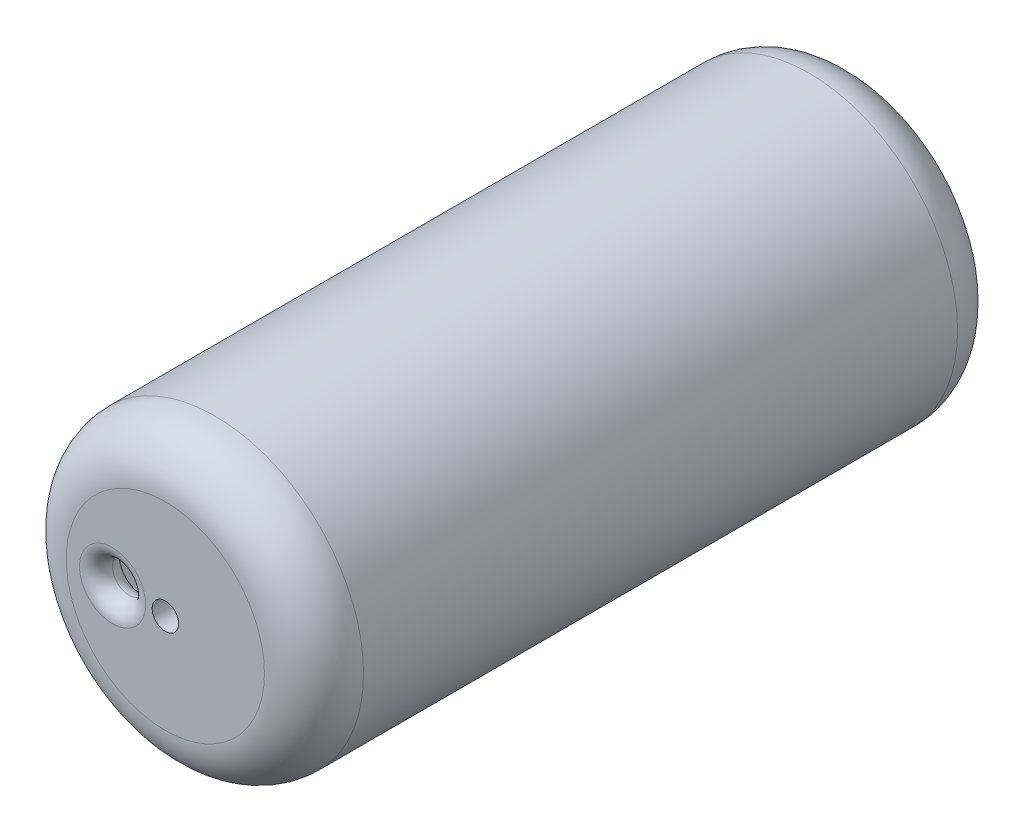
from build123d import *

# Parameters (mm, degrees)
SKETCH2_R           = 14.2875
BOSS_EXTRUDE1_DEPTH = 3.175
SKETCH3_R           = 14.2875
SKETCH3_R_2         = 11.7475
BOSS_EXTRUDE2_DEPTH = 60.2742
SKETCH4_R           = 14.2875
BOSS_EXTRUDE3_DEPTH = 3.175
SKETCH5_R           = 1.27
SKETCH5_R_2         = 1.5875
CUT_EXTRUDE1_DEPTH  = 70.620753645
FILLET1_R           = 4.7625
FILLET2_R           = 1.5875


with BuildPart() as part:
    # Sketch2 → Boss-Extrude1 (new body)
    with BuildSketch(Plane.XY):
        Circle(SKETCH2_R)
    extrude(amount=BOSS_EXTRUDE1_DEPTH)

    # Sketch3 → Boss-Extrude2 (add)
    with BuildSketch(Plane.XY.offset(3.175)):
        Circle(SKETCH3_R)
        Circle(SKETCH3_R_2, mode=Mode.SUBTRACT)
    extrude(amount=BOSS_EXTRUDE2_DEPTH)

    # Sketch4 → Boss-Extrude3 (add)
    with BuildSketch(Plane.XY.offset(63.4492)):
        Circle(SKETCH4_R)
    extrude(amount=BOSS_EXTRUDE3_DEPTH)

    # Sketch5 → Cut-Extrude1 (cut, through all)
    with BuildSketch(Plane.XY.offset(66.6242)):
        Circle(SKETCH5_R)
        with Locations((-5.08, 0)):
            Circle(SKETCH5_R_2)
    extrude(amount=-CUT_EXTRUDE1_DEPTH, mode=Mode.SUBTRACT)

    # Fillet1
    fillet1_edges = [part.edges().sort_by_distance(p)[0] for p in [
        (-14.2875, 0, 66.6242),
        (-14.2875, 0, 0),
    ]]
    fillet(fillet1_edges, radius=FILLET1_R)

    # Fillet2
    fillet2_edges = [part.edges().sort_by_distance(p)[0] for p in [
        (-6.6675, 0, 3.175),
        (-6.6675, 0, 63.4492),
        (-6.6675, 0, 0),
        (-6.6675, 0, 66.6242),
    ]]
    fillet(fillet2_edges, radius=FILLET2_R - 0.0001)  # a hair under: the kernel refuses the full size


solid = part.part
